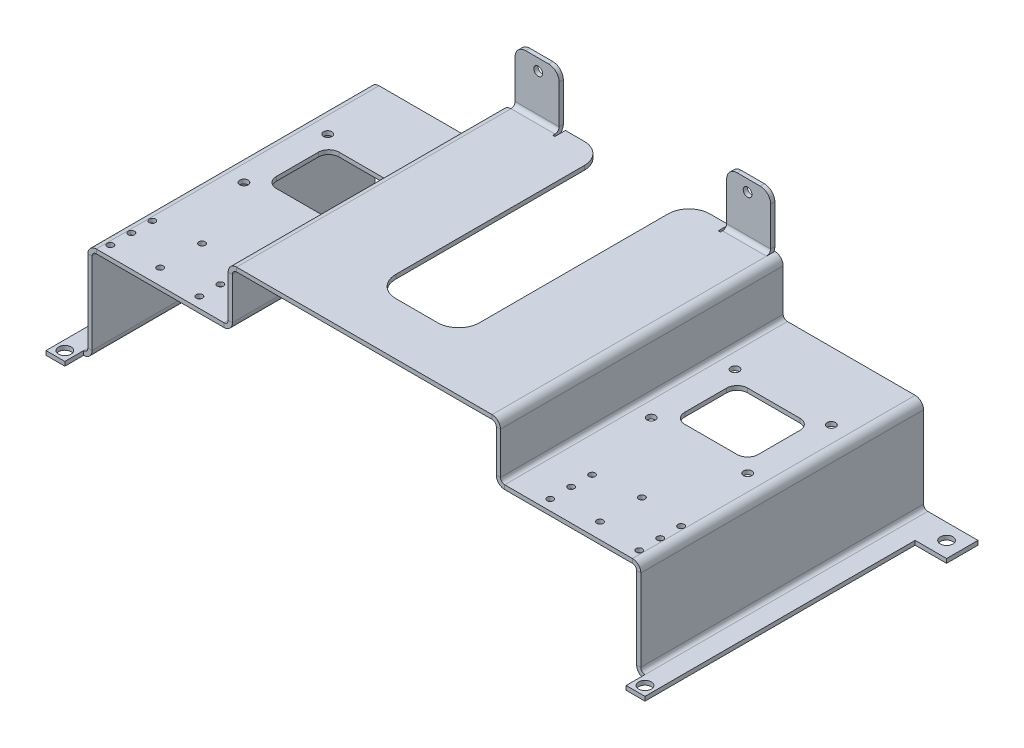
from build123d import *

# Parameters (mm, degrees)
SKETCH_1_W               = 10
SKETCH_1_H               = 3
EXTRUDE_1_DEPTH          = 135
SKETCH_2_W               = 40
SKETCH_2_H               = 124.505736859
CUT_EXTRUDE_1_DEPTH      = 314.416655588
SHEET_METAL_1_DEPTH      = 135
SHEET_METAL_1_2_DEPTH    = 135
FILLET_1_R               = 10
SKETCH_7_W               = 15
SKETCH_7_H               = 15
EXTRUDE_2_DEPTH          = 2
SKETCH_9_R               = 3
CUT_EXTRUDE_2_DEPTH      = 326.898757285
SKETCH_10_R              = 1.5
CUT_EXTRUDE_3_DEPTH      = 322.524493624
SKETCH_11_W              = 9
SKETCH_11_H              = 9
SKETCH_11_R              = 3
EXTRUDE_3_DEPTH          = 2
SM_START                 = 65
SM_EDGE_FLANGE_1_DEPTH   = 26
SM_EDGE_FLANGE_1_2_DEPTH = 4
SM_START_2               = 90
SM_EDGE_FLANGE_1_3_DEPTH = 1
SM_START_3               = 69
SM_EDGE_FLANGE_1_4_DEPTH = 21
SM_START_4               = 169
SM_EDGE_FLANGE_2_DEPTH   = 22
SM_EDGE_FLANGE_2_2_DEPTH = 1
SM_START_5               = 170
SM_EDGE_FLANGE_2_3_DEPTH = 21
SKETCH_18_R              = 2.1
CUT_EXTRUDE_4_DEPTH      = 336.872371594
SKETCH_19_R              = 2
CUT_EXTRUDE_5_DEPTH      = 327.408103453
CUT_EXTRUDE_6_REACH      = 328.086
SKETCH_20_W              = 35
SKETCH_20_H              = 30
FILLET_2_R               = 5
FILLET_3_R               = 5


# Read off the part's stored shape, not the designer's step: Преобразовать-Твердое тело1, Ребро-кромка1, Ребро-кромка2
with BuildPart() as part:
    # Sketch 1 → Бобышка-Вытянуть1 (new body)
    with BuildSketch(Plane.XY):
        Polygon((-3, 0), (0, 0), (0, 45), (67, 45), (67, 71), (110, 71), (130, 71), (130, 74), (110, 74), (64, 74), (64, 48), (-3, 48), (-3, 3), align=None)
        Polygon((130, 74), (130, 71), (150, 71), (193, 71), (193, 45), (260, 45), (260, 0), (263, 0), (273, 0), (273, 5), (263, 5), (263, 48), (196, 48), (196, 74), (150, 74), align=None)
        with Locations((-8, 1.5)):
            Rectangle(SKETCH_1_W, SKETCH_1_H)
    extrude(amount=EXTRUDE_1_DEPTH)

    # Sketch 2 → Вырез-Вытянуть1 (cut, through all)
    with BuildSketch(Plane(origin=(0, 74, 0), x_dir=(1, 0, 0), z_dir=(0, 1, 0))):
        with Locations((130, -47.747131571)):
            Rectangle(SKETCH_2_W, SKETCH_2_H)
    extrude(amount=-CUT_EXTRUDE_1_DEPTH, mode=Mode.SUBTRACT)

    # Sheet Metal 1 outline → Sheet Metal 1 (cut)
    with BuildSketch(Plane.XY):
        with BuildLine():
            ThreePointArc((264, 0), (261.171572875, 1.171572875), (260, 4))
            Line((260, 4), (260, 0))
            Line((260, 0), (264, 0))
        make_face()
        with BuildLine():
            Line((264, 2), (273, 2))
            Line((273, 2), (273, 5))
            Line((273, 5), (263, 5))
            Line((263, 5), (263, 48))
            Line((263, 48), (196, 48))
            Line((196, 48), (196, 74))
            Line((196, 74), (64, 74))
            Line((64, 74), (64, 48))
            Line((64, 48), (-3, 48))
            Line((-3, 48), (-3, 3))
            Line((-3, 3), (-13, 3))
            Line((-13, 3), (-13, 2))
            Line((-13, 2), (-4, 2))
            ThreePointArc((-4, 2), (-2.585786438, 2.585786438), (-2, 4))
            Line((-2, 4), (-2, 43))
            ThreePointArc((-2, 43), (-0.828427125, 45.828427125), (2, 47))
            Line((2, 47), (63, 47))
            ThreePointArc((63, 47), (64.414213562, 47.585786438), (65, 49))
            Line((65, 49), (65, 69))
            ThreePointArc((65, 69), (66.171572875, 71.828427125), (69, 73))
            Line((69, 73), (191, 73))
            ThreePointArc((191, 73), (193.828427125, 71.828427125), (195, 69))
            Line((195, 69), (195, 49))
            ThreePointArc((195, 49), (195.585786438, 47.585786438), (197, 47))
            Line((197, 47), (258, 47))
            ThreePointArc((258, 47), (260.828427125, 45.828427125), (262, 43))
            Line((262, 43), (262, 4))
            ThreePointArc((262, 4), (262.585786438, 2.585786438), (264, 2))
        make_face()
        with BuildLine():
            Line((193, 45), (197, 45))
            ThreePointArc((197, 45), (194.171572875, 46.171572875), (193, 49))
            Line((193, 49), (193, 45))
        make_face()
        with BuildLine():
            Line((67, 45), (67, 49))
            ThreePointArc((67, 49), (65.828427125, 46.171572875), (63, 45))
            Line((63, 45), (67, 45))
        make_face()
        with BuildLine():
            Line((0, 0), (0, 4))
            ThreePointArc((0, 4), (-1.171572875, 1.171572875), (-4, 0))
            Line((-4, 0), (0, 0))
        make_face()
    extrude(amount=SHEET_METAL_1_DEPTH, mode=Mode.SUBTRACT)

    # Sheet Metal 1 2 outline → Sheet Metal 1 2 (add)
    with BuildSketch(Plane.XY):
        with BuildLine():
            ThreePointArc((258, 45), (259.414213562, 44.414213562), (260, 43))
            Line((260, 43), (260, 45))
            Line((260, 45), (258, 45))
        make_face()
        with BuildLine():
            ThreePointArc((191, 71), (192.414213562, 70.414213562), (193, 69))
            Line((193, 69), (193, 71))
            Line((193, 71), (191, 71))
        make_face()
        with BuildLine():
            ThreePointArc((67, 69), (67.585786438, 70.414213562), (69, 71))
            Line((69, 71), (67, 71))
            Line((67, 71), (67, 69))
        make_face()
        with BuildLine():
            ThreePointArc((0, 43), (0.585786438, 44.414213562), (2, 45))
            Line((2, 45), (0, 45))
            Line((0, 45), (0, 43))
        make_face()
    extrude(amount=SHEET_METAL_1_2_DEPTH)

    # Скругление1
    fillet_1_edges = [part.edges().sort_by_distance(p)[0] for p in [
        (150, 72, 0),
        (150, 72, 110),
        (110, 72, 110),
        (110, 72, 0),
    ]]
    fillet(fillet_1_edges, radius=FILLET_1_R)

    # Эскиз7 → Бобышка-Вытянуть2 (add)
    with BuildSketch(Plane.XZ):
        with Locations((-20.5, 7.5)):
            Rectangle(SKETCH_7_W, SKETCH_7_H)
        with Locations((280.5, 7.5)):
            Rectangle(SKETCH_7_W, SKETCH_7_H)
    extrude(amount=-EXTRUDE_2_DEPTH)

    # Эскиз9 → Вырез-Вытянуть2 (cut, through all)
    with BuildSketch(Plane(origin=(0, 2, 0), x_dir=(1, 0, 0), z_dir=(0, 1, 0))):
        with Locations(Location((280.5, -7.5, 0), (0, 0, 270))):
            Circle(SKETCH_9_R)
        with Locations(Location((-20.5, -7.5, 0), (0, 0, 270))):
            Circle(SKETCH_9_R)
    extrude(amount=-CUT_EXTRUDE_2_DEPTH, mode=Mode.SUBTRACT)

    # Эскиз10 → Вырез-Вытянуть3 (cut, through all)
    with BuildSketch(Plane(origin=(0, 47, 0), x_dir=(1, 0, 0), z_dir=(0, 1, 0))):
        with Locations(Location((3.75, -130, 0), (0, 0, 270))):
            Circle(SKETCH_10_R)
        with Locations(Location((3.75, -120, 0), (0, 0, 270))):
            Circle(SKETCH_10_R)
        with Locations(Location((3.75, -110, 0), (0, 0, 270))):
            Circle(SKETCH_10_R)
        with Locations(Location((25, -107.5, 0), (0, 0, 270))):
            Circle(SKETCH_10_R)
        with Locations(Location((25, -127.5, 0), (0, 0, 270))):
            Circle(SKETCH_10_R)
        with Locations(Location((46.25, -130, 0), (0, 0, 270))):
            Circle(SKETCH_10_R)
        with Locations(Location((46.25, -120, 0), (0, 0, 270))):
            Circle(SKETCH_10_R)
        with Locations(Location((46.25, -110, 0), (0, 0, 270))):
            Circle(SKETCH_10_R)
        with Locations(Location((213.75, -130, 0), (0, 0, 270))):
            Circle(SKETCH_10_R)
        with Locations(Location((213.75, -120, 0), (0, 0, 270))):
            Circle(SKETCH_10_R)
        with Locations(Location((213.75, -110, 0), (0, 0, 270))):
            Circle(SKETCH_10_R)
        with Locations(Location((235, -107.5, 0), (0, 0, 270))):
            Circle(SKETCH_10_R)
        with Locations(Location((235, -127.5, 0), (0, 0, 270))):
            Circle(SKETCH_10_R)
        with Locations(Location((256.25, -130, 0), (0, 0, 270))):
            Circle(SKETCH_10_R)
        with Locations(Location((256.25, -120, 0), (0, 0, 270))):
            Circle(SKETCH_10_R)
        with Locations(Location((256.25, -110, 0), (0, 0, 270))):
            Circle(SKETCH_10_R)
    extrude(amount=-CUT_EXTRUDE_3_DEPTH, mode=Mode.SUBTRACT)

    # Эскиз11 → Бобышка-Вытянуть3 (add)
    # profile 1 of 2: a face of its own
    with BuildSketch(Plane(origin=(0, 2, 0), x_dir=(1, 0, 0), z_dir=(0, 1, 0))):
        with Locations((-8.5, -139.5)):
            Rectangle(SKETCH_11_W, SKETCH_11_H)
        with Locations(Location((-8.5, -139.5, 0), (0, 0, 270))):
            Circle(SKETCH_11_R, mode=Mode.SUBTRACT)
    # profile 2 of 2: a face of its own
    with BuildSketch(Plane(origin=(0, 2, 0), x_dir=(1, 0, 0), z_dir=(0, 1, 0))):
        with Locations((268.5, -139.5)):
            Rectangle(SKETCH_11_W, SKETCH_11_H)
        with Locations(Location((268.5, -139.5, 0), (0, 0, 270))):
            Circle(SKETCH_11_R, mode=Mode.SUBTRACT)
    extrude(amount=-EXTRUDE_3_DEPTH)

    # Ребро-кромка1 outline → Ребро-кромка1 (cut)
    with BuildSketch(Plane.YZ.offset(SM_START)):
        with BuildLine():
            Line((71, 4), (69, 4))
            Line((69, 4), (69, 0))
            Line((69, 0), (73, 0))
            Line((73, 0), (73, 0.535898384))
            ThreePointArc((73, 0.535898384), (71.535898385, 2), (71, 4))
        make_face()
    extrude(amount=SM_EDGE_FLANGE_1_DEPTH, mode=Mode.SUBTRACT)

    # Sm Edge Flange 1 2 outline → Sm Edge Flange 1 2 (cut)
    with BuildSketch(Plane.YZ.offset(SM_START)):
        with BuildLine():
            Line((73, 4), (71, 4))
            ThreePointArc((71, 4), (71.535898385, 2), (73, 0.535898384))
            Line((73, 0.535898384), (73, 4))
        make_face()
    extrude(amount=SM_EDGE_FLANGE_1_2_DEPTH, mode=Mode.SUBTRACT)

    # Sm Edge Flange 1 3 outline → Sm Edge Flange 1 3 (cut)
    with BuildSketch(Plane.YZ.offset(SM_START_2)):
        with BuildLine():
            Line((71, 5), (71, 4))
            ThreePointArc((71, 4), (71.535898385, 2), (73, 0.535898384))
            Line((73, 0.535898384), (73, 5))
            Line((73, 5), (71, 5))
        make_face()
    extrude(amount=SM_EDGE_FLANGE_1_3_DEPTH, mode=Mode.SUBTRACT)

    # Sm Edge Flange 1 4 outline → Sm Edge Flange 1 4 (add)
    with BuildSketch(Plane.YZ.offset(SM_START_3)):
        with BuildLine():
            ThreePointArc((75, 2), (73.585786438, 2.585786438), (73, 4))
            Line((73, 4), (73, 0.535898384))
            ThreePointArc((73, 0.535898384), (73.96472382, 0.136296695), (75, 0))
            Line((75, 0), (98.5, 0))
            Line((98.5, 0), (98.5, 2))
            Line((98.5, 2), (75, 2))
        make_face()
    extrude(amount=SM_EDGE_FLANGE_1_4_DEPTH)

    # Ребро-кромка2 outline → Ребро-кромка2 (cut)
    with BuildSketch(Plane.YZ.offset(SM_START_4)):
        with BuildLine():
            Line((73, 0), (73, 0.535898384))
            ThreePointArc((73, 0.535898384), (71.535898385, 2), (71, 4))
            Line((71, 4), (71, 0))
            Line((71, 0), (73, 0))
        make_face()
    extrude(amount=SM_EDGE_FLANGE_2_DEPTH, mode=Mode.SUBTRACT)

    # Sm Edge Flange 2 2 outline → Sm Edge Flange 2 2 (cut)
    with BuildSketch(Plane.YZ.offset(SM_START_4)):
        with BuildLine():
            ThreePointArc((71, 4), (71.535898385, 2), (73, 0.535898384))
            Line((73, 0.535898384), (73, 5))
            Line((73, 5), (71, 5))
            Line((71, 5), (71, 4))
        make_face()
    extrude(amount=SM_EDGE_FLANGE_2_2_DEPTH, mode=Mode.SUBTRACT)

    # Sm Edge Flange 2 3 outline → Sm Edge Flange 2 3 (add)
    with BuildSketch(Plane.YZ.offset(SM_START_5)):
        with BuildLine():
            Line((75, 0), (98.5, 0))
            Line((98.5, 0), (98.5, 2))
            Line((98.5, 2), (75, 2))
            ThreePointArc((75, 2), (73.585786438, 2.585786438), (73, 4))
            Line((73, 4), (73, 0.535898384))
            ThreePointArc((73, 0.535898384), (73.96472382, 0.136296695), (75, 0))
        make_face()
    extrude(amount=SM_EDGE_FLANGE_2_3_DEPTH)

    # Эскиз18 → Вырез-Вытянуть4 (cut, through all)
    with BuildSketch(Plane.XY.offset(2)):
        with Locations((80, 93)):
            Circle(SKETCH_18_R)
        with Locations((180, 93)):
            Circle(SKETCH_18_R)
    extrude(amount=-CUT_EXTRUDE_4_DEPTH, mode=Mode.SUBTRACT)

    # Эскиз19 → Вырез-Вытянуть5 (cut, through all)
    with BuildSketch(Plane.XZ.offset(-45)):
        with Locations(Location((9.75, 72.25, 0), (0, 0, 270))):
            Circle(SKETCH_19_R)
        with Locations(Location((55.75, 72.25, 0), (0, 0, 270))):
            Circle(SKETCH_19_R)
        with Locations(Location((9.75, 32.25, 0), (0, 0, 270))):
            Circle(SKETCH_19_R)
        with Locations(Location((55.75, 32.25, 0), (0, 0, 270))):
            Circle(SKETCH_19_R)
        with Locations(Location((204.25, 32.25, 0), (0, 0, 270))):
            Circle(SKETCH_19_R)
        with Locations(Location((250.25, 32.25, 0), (0, 0, 270))):
            Circle(SKETCH_19_R)
        with Locations(Location((204.25, 72.25, 0), (0, 0, 270))):
            Circle(SKETCH_19_R)
        with Locations(Location((250.25, 72.25, 0), (0, 0, 270))):
            Circle(SKETCH_19_R)
    extrude(amount=-CUT_EXTRUDE_5_DEPTH, mode=Mode.SUBTRACT)

    # Эскиз20 → Вырез-Вытянуть6 (cut, up to next)
    with BuildSketch(Plane(origin=(0, 47, 0), x_dir=(1, 0, 0), z_dir=(0, 1, 0)), mode=Mode.PRIVATE) as cut_extrude_6_sk1:
        with Locations((32.5, -52)):
            Rectangle(SKETCH_20_W, SKETCH_20_H)
    cut_extrude_6_tool1 = extrude(cut_extrude_6_sk1.sketch, amount=-CUT_EXTRUDE_6_REACH, mode=Mode.PRIVATE) & part.part
    # Эскиз20 → Вырез-Вытянуть6 (cut, up to next)
    with BuildSketch(Plane(origin=(0, 47, 0), x_dir=(1, 0, 0), z_dir=(0, 1, 0)), mode=Mode.PRIVATE) as cut_extrude_6_sk2:
        with Locations((227.5, -52)):
            Rectangle(SKETCH_20_W, SKETCH_20_H)
    cut_extrude_6_tool2 = extrude(cut_extrude_6_sk2.sketch, amount=-CUT_EXTRUDE_6_REACH, mode=Mode.PRIVATE) & part.part
    add(cut_extrude_6_tool1.solids().sort_by_distance((32.5, 47, 52))[0], mode=Mode.SUBTRACT)
    add(cut_extrude_6_tool2.solids().sort_by_distance((227.5, 47, 52))[0], mode=Mode.SUBTRACT)

    # Скругление2
    fillet_2_edges = [part.edges().sort_by_distance(p)[0] for p in [
        (15, 46, 67),
        (15, 46, 37),
        (50, 46, 37),
        (50, 46, 67),
        (210, 46, 67),
        (210, 46, 37),
        (245, 46, 37),
        (245, 46, 67),
    ]]
    fillet(fillet_2_edges, radius=FILLET_2_R)

    # Скругление3
    fillet_3_edges = [part.edges().sort_by_distance(p)[0] for p in [
        (90, 98.5, 1),
        (69, 98.5, 1),
        (191, 98.5, 1),
        (170, 98.5, 1),
    ]]
    fillet(fillet_3_edges, radius=FILLET_3_R)


solid = part.part
